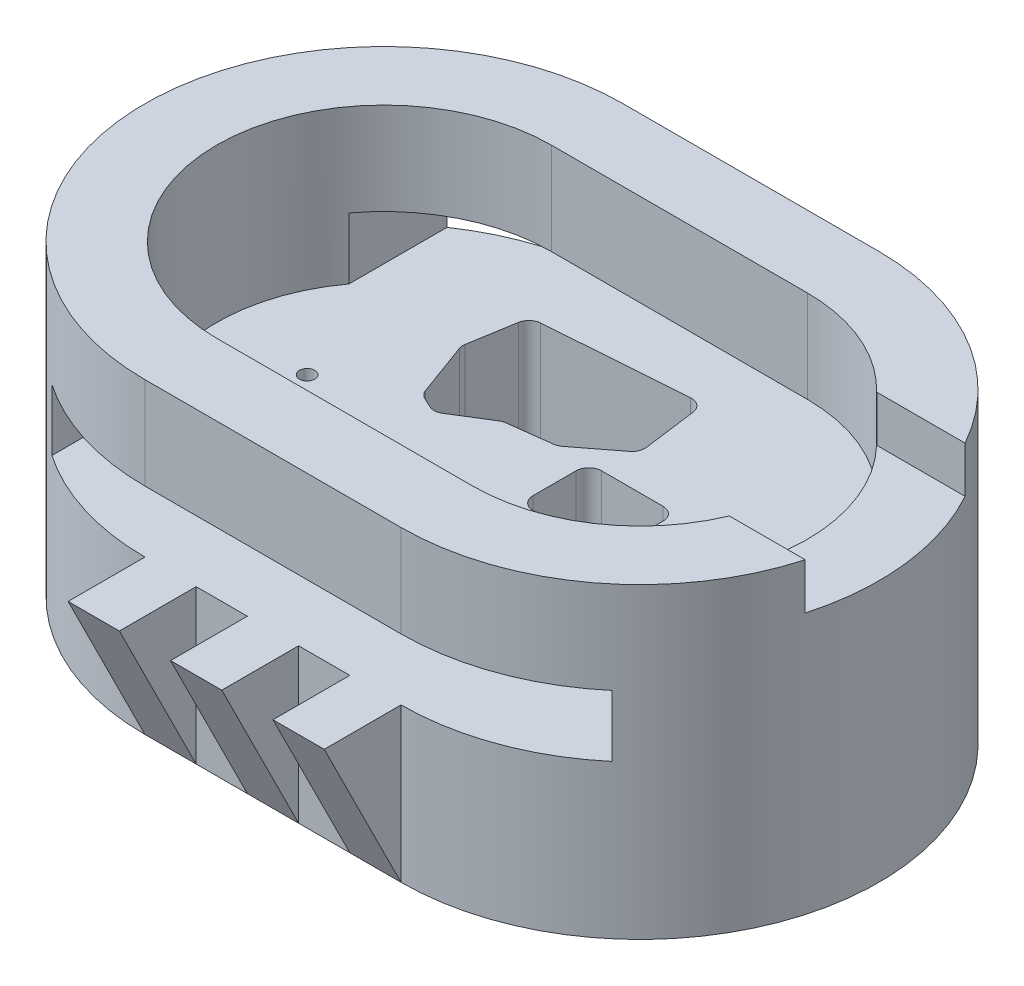
from build123d import *

# Parameters (mm, degrees)
LIP_DEPTH                    = 6
BASE_DEPTH                   = 3
LAMDABREGMAGUIDES_DEPTH      = 5
LAMDABREGMAGUIDES_DEPTH_BACK = 5
SKETCH16_R                   = 0.15
SKETCH16_R_2                 = 0.2
SKETCH3_W                    = 10.638387248
SKETCH3_H                    = 1.2
CUT4ACRYLIC_DEPTH            = 10
SKETCH4_W                    = 2.35
SKETCH4_H                    = 3.533
CUTFORGROUNDPIN_DEPTH        = 0.9
BOSS_EXTRUDE6_DEPTH          = 1
CRVPATTERN1_START            = 3.5
CRVPATTERN1_DEPTH            = 1
CRVPATTERN1_START_2          = 5.5
CRVPATTERN1_2_DEPTH          = 1
BOSS_EXTRUDE7_DEPTH          = 1
CRVPATTERN5_START            = 3.5
CRVPATTERN5_DEPTH            = 1
CRVPATTERN5_START_2          = 5.5
CRVPATTERN5_2_DEPTH          = 1
CUT_EXTRUDE1_DEPTH           = 10
CUT_EXTRUDE3_DEPTH           = 10
CUT_EXTRUDE3_DEPTH_BACK      = 10
SKETCH32_W                   = 1.7
SKETCH32_H                   = 1.34
FILLET1_R                    = 0.25


# Read off the part's stored shape, not the designer's step: Lip, CrvPattern1, CrvPattern5
with BuildPart() as part:
    # Lip outline → Lip (new body)
    with BuildSketch(Plane(origin=(0, 0, 0), x_dir=(1, 0, 0), z_dir=(0, 1, 0))):
        with BuildLine():
            ThreePointArc((1.5, 4.6665), (-3.1665, 0), (1.5, -4.6665))
            Line((1.5, -4.6665), (6.5, -4.6665))
            ThreePointArc((6.5, -4.6665), (11.1665, 0), (6.5, 4.6665))
            Line((6.5, 4.6665), (1.5, 4.6665))
        make_face()
        with BuildLine():
            Line((6.5, -3.2665), (1.5, -3.2665))
            ThreePointArc((1.5, -3.2665), (-1.7665, 0), (1.5, 3.2665))
            Line((1.5, 3.2665), (6.5, 3.2665))
            ThreePointArc((6.5, 3.2665), (9.7665, 0), (6.5, -3.2665))
        make_face(mode=Mode.SUBTRACT)
    extrude(amount=LIP_DEPTH)

    # Sketch2 → Base (add)
    with BuildSketch(Plane(origin=(0, 0, 0), x_dir=(1, 0, 0), z_dir=(0, 1, 0))):
        with BuildLine():
            Line((6.5, -3.2665), (1.5, -3.2665))
            ThreePointArc((1.5, -3.2665), (-1.7665, 0), (1.5, 3.2665))
            Line((1.5, 3.2665), (6.5, 3.2665))
            ThreePointArc((6.5, 3.2665), (9.7665, 0), (6.5, -3.2665))
        make_face()
    extrude(amount=BASE_DEPTH)

    # Sketch16 → LamdaBregmaGuides (cut, two sides: drawn at the far end of the back side and taken through both)
    with BuildSketch(Plane(origin=(0, 0, 0), x_dir=(1, 0, 0), z_dir=(0, 1, 0)).offset(-LAMDABREGMAGUIDES_DEPTH_BACK)):
        with Locations(Location((0, 0, 0), (0, 0, 270))):
            Circle(SKETCH16_R)
        with Locations(Location((9, 0, 0), (0, 0, 270))):
            Circle(SKETCH16_R)
        with Locations(Location((8, -1.75, 0), (0, 0, 270))):
            Circle(SKETCH16_R_2)
    extrude(amount=LAMDABREGMAGUIDES_DEPTH + LAMDABREGMAGUIDES_DEPTH_BACK, mode=Mode.SUBTRACT)

    # Sketch3 → Cut4Acrylic (cut)
    with BuildSketch(Plane.XY.offset(4.6665)):
        with Locations((4.193105486, 3.6)):
            Rectangle(SKETCH3_W, SKETCH3_H)
    extrude(amount=-CUT4ACRYLIC_DEPTH, mode=Mode.SUBTRACT)

    # Sketch4 → CutforGroundPin (cut)
    with BuildSketch(Plane(origin=(0, 6, 0), x_dir=(1, 0, 0), z_dir=(0, 1, 0))):
        with Locations((10.030760676, 0.5)):
            Rectangle(SKETCH4_W, SKETCH4_H)
    extrude(amount=-CUTFORGROUNDPIN_DEPTH, mode=Mode.SUBTRACT)

    # Sketch21 → Boss-Extrude6 (add)
    with BuildSketch(Plane(origin=(1.5, 0, 0), x_dir=(0, 0, -1), z_dir=(1, 0, 0))):
        Polygon((-4.6665, 3), (-6.1665, 3), (-4.6665, 0), align=None)
    extrude(amount=BOSS_EXTRUDE6_DEPTH)

    # CrvPattern1 outline → CrvPattern1 (add)
    with BuildSketch(Plane.YZ.offset(CRVPATTERN1_START)):
        Polygon((0, 4.6665), (3, 4.6665), (3, 6.1665), align=None)
    extrude(amount=CRVPATTERN1_DEPTH)

    # CrvPattern1 2 outline → CrvPattern1 2 (add)
    with BuildSketch(Plane.YZ.offset(CRVPATTERN1_START_2)):
        Polygon((0, 4.6665), (3, 4.6665), (3, 6.1665), align=None)
    extrude(amount=CRVPATTERN1_2_DEPTH)

    # Sketch22 → Boss-Extrude7 (add)
    with BuildSketch(Plane(origin=(1.5, 0, 0), x_dir=(0, 0, -1), z_dir=(1, 0, 0))):
        Polygon((4.6665, 0), (4.6665, 3), (6.1665, 3), align=None)
    extrude(amount=BOSS_EXTRUDE7_DEPTH)

    # CrvPattern5 outline → CrvPattern5 (add)
    with BuildSketch(Plane.YZ.offset(CRVPATTERN5_START)):
        Polygon((0, -4.6665), (3, -6.1665), (3, -4.6665), align=None)
    extrude(amount=CRVPATTERN5_DEPTH)

    # CrvPattern5 2 outline → CrvPattern5 2 (add)
    with BuildSketch(Plane.YZ.offset(CRVPATTERN5_START_2)):
        Polygon((0, -4.6665), (3, -6.1665), (3, -4.6665), align=None)
    extrude(amount=CRVPATTERN5_2_DEPTH)

    # Sketch31 → Cut-Extrude1 (cut)
    with BuildSketch(Plane(origin=(0, 3, 0), x_dir=(1, 0, 0), z_dir=(0, 1, 0))):
        Polygon((1.21, 3.14), (1.02, 1.99), (1.46, 0.79), (1.86, 0.6), (2.7, 1.12), (3.65, 1.24), (4.56, 1.94), (4.37, 3.37), align=None)
    extrude(amount=-CUT_EXTRUDE1_DEPTH, mode=Mode.SUBTRACT)

    # Sketch32 → Cut-Extrude3 (cut, two sides: drawn at the far end of the back side and taken through both)
    with BuildSketch(Plane(origin=(0, 0, 0), x_dir=(1, 0, 0), z_dir=(0, 1, 0)).offset(-CUT_EXTRUDE3_DEPTH_BACK)):
        with Locations((5.1, 0.58)):
            Rectangle(SKETCH32_W, SKETCH32_H)
    extrude(amount=CUT_EXTRUDE3_DEPTH + CUT_EXTRUDE3_DEPTH_BACK, mode=Mode.SUBTRACT)

    # Fillet1
    fillet1_edges = [part.edges().sort_by_distance(p)[0] for p in [
        (1.21, 1.5, -3.14),
        (4.37, 1.5, -3.37),
        (4.56, 1.5, -1.94),
        (3.65, 1.5, -1.24),
        (2.7, 1.5, -1.12),
        (1.86, 1.5, -0.6),
        (1.46, 1.5, -0.79),
        (1.02, 1.5, -1.99),
        (5.95, 1.5, 0.09),
        (5.95, 1.5, -1.25),
        (4.25, 1.5, -1.25),
        (4.25, 1.5, 0.09),
    ]]
    fillet(fillet1_edges, radius=FILLET1_R)


solid = part.part
